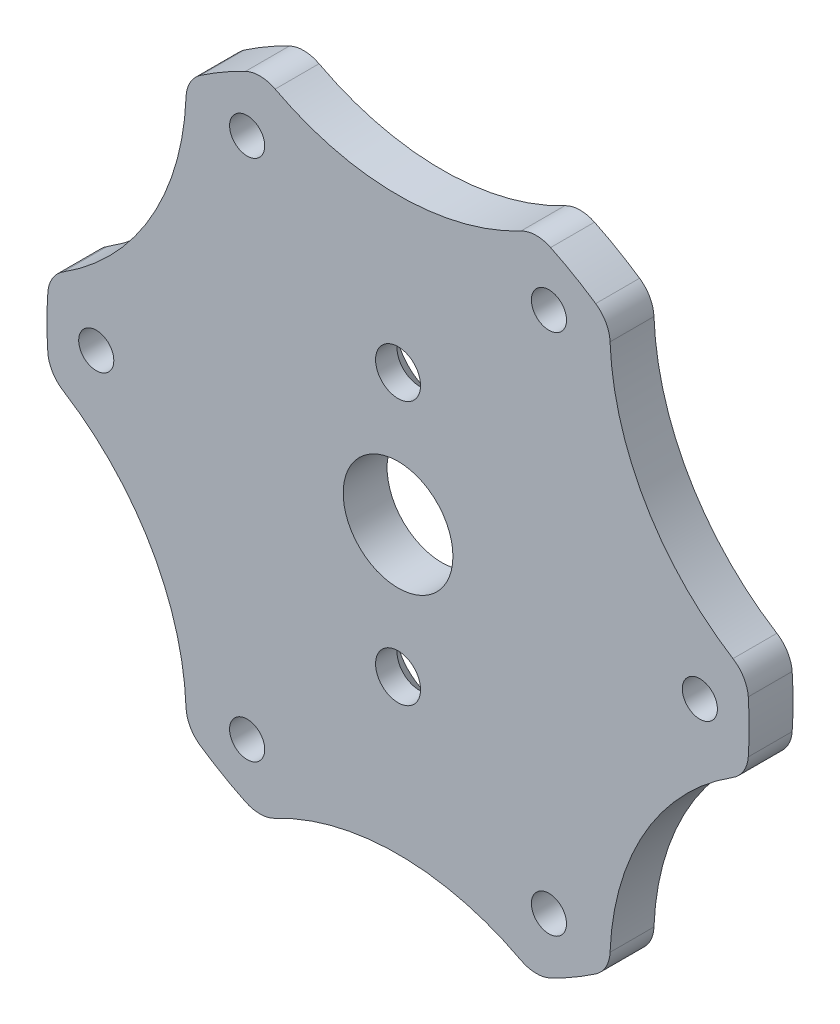
from build123d import *

# Parameters (mm, degrees)
SKETCH_1_R               = 32
SKETCH_1_R_2             = 5
EXTRUDE_1_DEPTH          = 4
SKETCH_2_R               = 2.05
CUT_EXTRUDE_1_DEPTH      = 5
SKETCH_3_R               = 24
CUT_EXTRUDE_2_DEPTH      = 10
PATTERN_CIRCULAR_1_COUNT = 6
SKETCH_4_R               = 1.6
CUT_EXTRUDE_3_DEPTH      = 23
PATTERN_CIRCULAR_2_COUNT = 6
FILLET_1_R               = 3


# Read off the part's stored shape, not the designer's step: 高级异型孔2
with BuildPart() as part:
    # 草图1 → 凸台-拉伸1 (new body)
    with BuildSketch(Plane.XY):
        Circle(SKETCH_1_R)
        Circle(SKETCH_1_R_2, mode=Mode.SUBTRACT)
    extrude(amount=EXTRUDE_1_DEPTH)

    # 草图2 → 切除-拉伸1 (cut)
    with BuildSketch(Plane.XY.offset(4)):
        with Locations((0, 12)):
            Circle(SKETCH_2_R)
        with Locations((0, -12)):
            Circle(SKETCH_2_R)
    extrude(amount=-CUT_EXTRUDE_1_DEPTH, mode=Mode.SUBTRACT)

    # 草图3 → 切除-拉伸2 (cut)
    with BuildSketch(Plane.XY.offset(4)):
        with Locations((0, 50)):
            Circle(SKETCH_3_R)
    cut_extrude_2 = extrude(amount=-CUT_EXTRUDE_2_DEPTH, mode=Mode.SUBTRACT)

    # 阵列(圆周)1: 切除-拉伸2 ×6 about axis
    pattern_circular_1_axis = Axis((0, 0, 0), (0, 0, 1))
    for i in range(1, PATTERN_CIRCULAR_1_COUNT):
        add(cut_extrude_2.rotate(pattern_circular_1_axis, i * 360 / PATTERN_CIRCULAR_1_COUNT), mode=Mode.SUBTRACT)

    # 草图4 → 切除-拉伸3 (cut)
    with BuildSketch(Plane.XY.offset(4)):
        with Locations((13.75, 23.815698604)):
            Circle(SKETCH_4_R)
    cut_extrude_3 = extrude(amount=-CUT_EXTRUDE_3_DEPTH, mode=Mode.SUBTRACT)

    # 阵列(圆周)2: 切除-拉伸3 ×6 about axis
    pattern_circular_2_axis = Axis((0, 0, 0), (0, 0, 1))
    for i in range(1, PATTERN_CIRCULAR_2_COUNT):
        add(cut_extrude_3.rotate(pattern_circular_2_axis, i * 360 / PATTERN_CIRCULAR_2_COUNT), mode=Mode.SUBTRACT)

    # 圆角1
    fillet_1_edges = [part.edges().sort_by_distance(p)[0] for p in [
        (-12.447071945, 29.48, 2),
        (12.447071945, 29.48, 2),
        (-31.753964876, 3.960519493, 2),
        (-19.306892931, 25.519480507, 2),
        (19.306892931, 25.519480507, 2),
        (31.753964876, 3.960519493, 2),
        (31.753964876, -3.960519493, 2),
        (19.306892931, -25.519480507, 2),
        (-19.306892931, -25.519480507, 2),
        (-31.753964876, -3.960519493, 2),
        (12.447071945, -29.48, 2),
        (-12.447071945, -29.48, 2),
    ]]
    fillet(fillet_1_edges, radius=FILLET_1_R)

    # 高级异型孔2 outline → 高级异型孔2 (revolve, cut)
    with BuildSketch(Plane.XZ.offset(12)):
        Polygon((2.25, 2.05), (2.05, 2.05), (2.05, 0), (4.3, 0), align=None)
    revolve(axis=Axis((0, -12, 0), (0, 0, 1)), mode=Mode.SUBTRACT)

    # Other 2 2 outline → Other 2 2 (revolve, cut)
    with BuildSketch(Plane.XZ.offset(-12)):
        Polygon((2.25, 2.05), (2.05, 2.05), (2.05, 0), (4.3, 0), align=None)
    revolve(axis=Axis((0, 12, 0), (0, 0, 1)), mode=Mode.SUBTRACT)


solid = part.part
